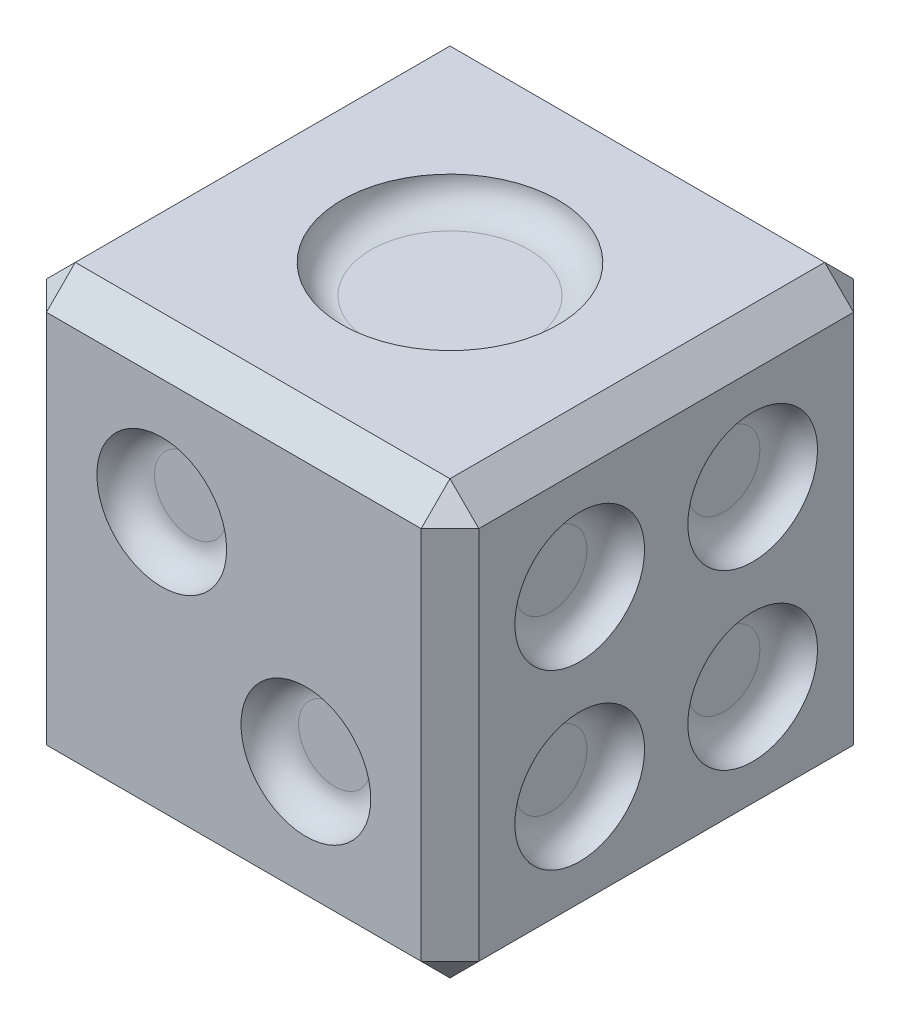
from build123d import *

# Parameters (mm, degrees)
SKETCH_3_W          = 30
SKETCH_3_H          = 30
EXTRUDE_2_DEPTH     = 30
CHAMFER_1_SIZE      = 2
SKETCH_5_R          = 7.5
CUT_EXTRUDE_1_DEPTH = 2
FILLET_2_R          = 2
SKETCH_8_R          = 3.5
CUT_EXTRUDE_2_DEPTH = 2
FILLET_3_R          = 2
SKETCH_9_R          = 4.5
CUT_EXTRUDE_3_DEPTH = 2
FILLET_4_R          = 2
SKETCH_10_R         = 4
CUT_EXTRUDE_4_DEPTH = 2
FILLET_5_R          = 2
SKETCH_11_R         = 4
CUT_EXTRUDE_5_DEPTH = 2
FILLET_6_R          = 2
SKETCH_12_R         = 4.5
CUT_EXTRUDE_6_DEPTH = 2
FILLET_7_R          = 2


with BuildPart() as part:
    # ｽｹｯﾁ3 → ﾎﾞｽ - 押し出し2 (new body)
    with BuildSketch(Plane(origin=(0, 0, 0), x_dir=(1, 0, 0), z_dir=(0, 1, 0))):
        with Locations((15, 15)):
            Rectangle(SKETCH_3_W, SKETCH_3_H)
    extrude(amount=EXTRUDE_2_DEPTH)

    # 面取り1
    chamfer_1_edges = [part.edges().sort_by_distance(p)[0] for p in [
        (30, 30, -15),
        (15, 30, -30),
        (0, 30, -15),
        (15, 0, -30),
        (30, 0, -15),
        (15, 0, 0),
        (0, 0, -15),
        (0, 15, -30),
        (30, 15, -30),
        (30, 15, 0),
        (0, 15, 0),
        (15, 30, 0),
    ]]
    chamfer(chamfer_1_edges, length=CHAMFER_1_SIZE)

    # ｽｹｯﾁ5 → ｶｯﾄ - 押し出し1 (cut)
    with BuildSketch(Plane(origin=(0, 30, 0), x_dir=(1, 0, 0), z_dir=(0, 1, 0))):
        with Locations(Location((15, 15, 0), (0, 0, 270))):
            Circle(SKETCH_5_R)
    extrude(amount=-CUT_EXTRUDE_1_DEPTH, mode=Mode.SUBTRACT)

    # ﾌｨﾚｯﾄ2
    fillet_2_edges = [part.edges().sort_by_distance(p)[0] for p in [
        (15, 28, -22.5),
    ]]
    fillet(fillet_2_edges, radius=FILLET_2_R - 0.0001)  # a hair under: the kernel refuses the full size

    # ｽｹｯﾁ8 → ｶｯﾄ - 押し出し2 (cut)
    with BuildSketch(Plane.XZ):
        with Locations(Location((9, -7, 0), (0, 0, 270))):
            Circle(SKETCH_8_R)
        with Locations(Location((9, -15, 0), (0, 0, 270))):
            Circle(SKETCH_8_R)
        with Locations(Location((9, -23, 0), (0, 0, 270))):
            Circle(SKETCH_8_R)
        with Locations(Location((21, -7, 0), (0, 0, 270))):
            Circle(SKETCH_8_R)
        with Locations(Location((21, -15, 0), (0, 0, 270))):
            Circle(SKETCH_8_R)
        with Locations(Location((21, -23, 0), (0, 0, 270))):
            Circle(SKETCH_8_R)
    extrude(amount=-CUT_EXTRUDE_2_DEPTH, mode=Mode.SUBTRACT)

    # ﾌｨﾚｯﾄ3
    fillet_3_edges = [part.edges().sort_by_distance(p)[0] for p in [
        (9, 2, -11.5),
        (9, 2, -19.5),
        (21, 2, -3.5),
        (21, 2, -11.5),
        (21, 2, -19.5),
        (9, 2, -3.5),
    ]]
    fillet(fillet_3_edges, radius=FILLET_3_R - 0.0001)  # a hair under: the kernel refuses the full size

    # ｽｹｯﾁ9 → ｶｯﾄ - 押し出し3 (cut)
    with BuildSketch(Plane.XY):
        with Locations((10, 20)):
            Circle(SKETCH_9_R)
        with Locations((20, 10)):
            Circle(SKETCH_9_R)
    extrude(amount=-CUT_EXTRUDE_3_DEPTH, mode=Mode.SUBTRACT)

    # ﾌｨﾚｯﾄ4
    fillet_4_edges = [part.edges().sort_by_distance(p)[0] for p in [
        (5.5, 20, -2),
        (15.5, 10, -2),
    ]]
    fillet(fillet_4_edges, radius=FILLET_4_R - 0.0001)  # a hair under: the kernel refuses the full size

    # ｽｹｯﾁ10 → ｶｯﾄ - 押し出し4 (cut)
    with BuildSketch(Plane(origin=(0, 0, -30), x_dir=(-1, 0, 0), z_dir=(0, 0, -1))):
        with Locations((-23, 23)):
            Circle(SKETCH_10_R)
        with Locations((-7, 23)):
            Circle(SKETCH_10_R)
        with Locations((-7, 7)):
            Circle(SKETCH_10_R)
        with Locations((-23, 7)):
            Circle(SKETCH_10_R)
        with Locations((-15, 15)):
            Circle(SKETCH_10_R)
    extrude(amount=-CUT_EXTRUDE_4_DEPTH, mode=Mode.SUBTRACT)

    # ﾌｨﾚｯﾄ5
    fillet_5_edges = [part.edges().sort_by_distance(p)[0] for p in [
        (11, 23, -28),
        (11, 7, -28),
        (19, 15, -28),
        (27, 7, -28),
        (27, 23, -28),
    ]]
    fillet(fillet_5_edges, radius=FILLET_5_R - 0.0001)  # a hair under: the kernel refuses the full size

    # ｽｹｯﾁ11 → ｶｯﾄ - 押し出し5 (cut)
    with BuildSketch(Plane.ZY):
        with Locations((-23, 23)):
            Circle(SKETCH_11_R)
        with Locations((-15, 15)):
            Circle(SKETCH_11_R)
        with Locations((-7, 7)):
            Circle(SKETCH_11_R)
    extrude(amount=-CUT_EXTRUDE_5_DEPTH, mode=Mode.SUBTRACT)

    # ﾌｨﾚｯﾄ6
    fillet_6_edges = [part.edges().sort_by_distance(p)[0] for p in [
        (2, 15, -19),
        (2, 7, -11),
        (2, 23, -27),
    ]]
    fillet(fillet_6_edges, radius=FILLET_6_R - 0.0001)  # a hair under: the kernel refuses the full size

    # ｽｹｯﾁ12 → ｶｯﾄ - 押し出し6 (cut)
    with BuildSketch(Plane(origin=(30, 0, 0), x_dir=(0, 0, -1), z_dir=(1, 0, 0))):
        with Locations((9, 21)):
            Circle(SKETCH_12_R)
        with Locations((21, 21)):
            Circle(SKETCH_12_R)
        with Locations((21, 9)):
            Circle(SKETCH_12_R)
        with Locations((9, 9)):
            Circle(SKETCH_12_R)
    extrude(amount=-CUT_EXTRUDE_6_DEPTH, mode=Mode.SUBTRACT)

    # ﾌｨﾚｯﾄ7
    fillet_7_edges = [part.edges().sort_by_distance(p)[0] for p in [
        (28, 9, -4.5),
        (28, 9, -16.5),
        (28, 21, -16.5),
        (28, 21, -4.5),
    ]]
    fillet(fillet_7_edges, radius=FILLET_7_R - 0.0001)  # a hair under: the kernel refuses the full size


solid = part.part
